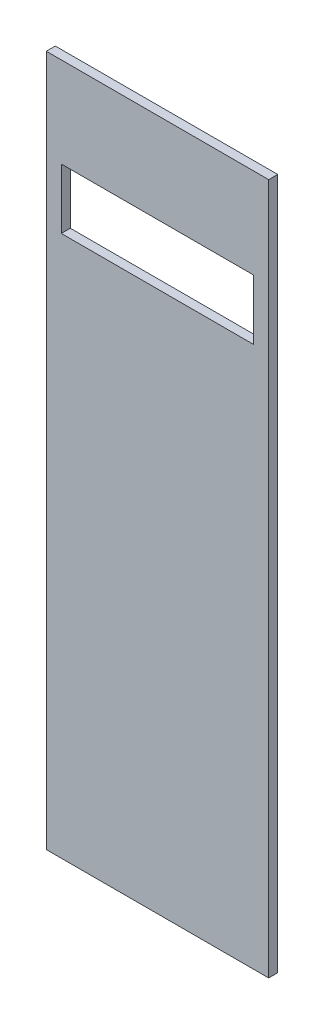
from build123d import *

# Parameters (mm, degrees)
ESBO_O1_W                = 370
ESBO_O1_H                = 1150
RESSALTO_EXTRUS_O1_DEPTH = 15
ESBO_O2_W                = 320
ESBO_O2_H                = 100
CORTE_EXTRUS_O1_DEPTH    = 15


with BuildPart() as part:
    # Esboço1 → Ressalto-extrusão1 (new body)
    with BuildSketch(Plane.XY):
        Rectangle(ESBO_O1_W, ESBO_O1_H)
    extrude(amount=RESSALTO_EXTRUS_O1_DEPTH)

    # Esboço2 → Corte-extrusão1 (cut)
    with BuildSketch(Plane.XY.offset(15)):
        with Locations((0, 375)):
            Rectangle(ESBO_O2_W, ESBO_O2_H)
    extrude(amount=-CORTE_EXTRUS_O1_DEPTH, mode=Mode.SUBTRACT)


solid = part.part
